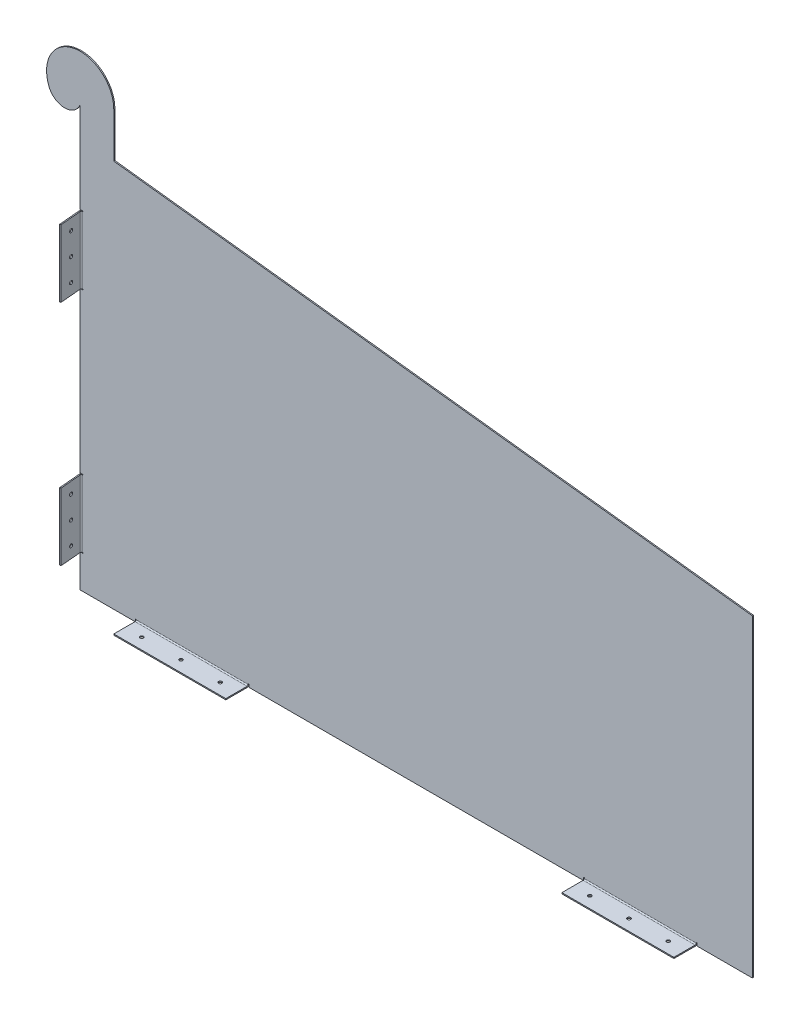
from build123d import *

# Parameters (mm, degrees)
BASE_FLANGE1_DEPTH            = 1
EDGE_FLANGE1_STRIP_W          = 6
EDGE_FLANGE1_STRIP_H          = 1
EDGE_FLANGE1_STRIP_CUT_DEPTH  = 100
EDGE_FLANGE1_RELIEF_W         = 6.5
EDGE_FLANGE1_RELIEF_H         = 0.5
EDGE_FLANGE1_RELIEF_CUT_DEPTH = 1
EDGE_FLANGE1_DEPTH            = 100
EDGE_FLANGE1_PROFILE_W        = 100
EDGE_FLANGE1_PROFILE_H        = 19
EDGE_FLANGE1_PROFILE_R        = 1.5
EDGE_FLANGE1_FLAT_DEPTH       = 1
EDGE_FLANGE2_START            = 29.5
EDGE_FLANGE2_DEPTH            = 61
EDGE_FLANGE2_2_DEPTH          = 0.5
EDGE_FLANGE2_START_2          = 90
EDGE_FLANGE2_3_DEPTH          = 0.5
EDGE_FLANGE2_START_3          = 30
EDGE_FLANGE2_4_DEPTH          = 60
EDGE_FLANGE2_5_OUTLINE_R      = 1.5
EDGE_FLANGE2_5_DEPTH          = 1


with BuildPart() as part:
    # Base-Flange1: sheet metal written as solids
    # Sketch1 → Base-Flange1 (new body)
    with BuildSketch(Plane.XY):
        with BuildLine():
            Line((0, 0), (0, 350))
            Line((0, 350), (0, 375))
            ThreePointArc((0, 375), (-13.854151002, 365.75), (-27.708302005, 375))
            ThreePointArc((-27.708302005, 375), (-5.863059775, 415.921497754), (30, 386.5))
            Line((30, 386.5), (30, 346.5))
            Line((30, 346.5), (600, 280))
            Line((600, 280), (600, 0))
            Line((600, 0), (0, 0))
        make_face()
    extrude(amount=-BASE_FLANGE1_DEPTH)

    # Edge-Flange1: sheet metal written as solids
    # Edge-Flange1 strip (on a plane across the edge) → Edge-Flange1 strip cut (cut)
    with BuildSketch(Plane.YZ.offset(450)):
        with Locations((-1, -0.5)):
            Rectangle(EDGE_FLANGE1_STRIP_W, EDGE_FLANGE1_STRIP_H)
    edge_flange1_strip_cut = extrude(amount=EDGE_FLANGE1_STRIP_CUT_DEPTH, mode=Mode.SUBTRACT)

    # Edge-Flange1 relief (on the sheet) → Edge-Flange1 relief cut (cut)
    with BuildSketch(Plane(origin=(450, 2, 0), x_dir=(0, 1, 0), z_dir=(0, 0, 1))):
        with Locations((-2.75, 0.25)):
            Rectangle(EDGE_FLANGE1_RELIEF_W, EDGE_FLANGE1_RELIEF_H)
        with Locations((-2.75, -100.25)):
            Rectangle(EDGE_FLANGE1_RELIEF_W, EDGE_FLANGE1_RELIEF_H)
    edge_flange1_relief_cut = extrude(amount=-EDGE_FLANGE1_RELIEF_CUT_DEPTH, mode=Mode.SUBTRACT)

    # Edge-Flange1 bend section (on a plane across the edge) → Edge-Flange1 (add)
    with BuildSketch(Plane.YZ.offset(450)):
        with BuildLine():
            Line((0, 1), (1, 1))
            ThreePointArc((1, 1), (1.292893219, 0.292893219), (2, 0))
            Line((2, 0), (2, -1))
            ThreePointArc((2, -1), (0.585786438, -0.414213562), (0, 1))
        make_face()
    edge_flange1 = extrude(amount=EDGE_FLANGE1_DEPTH)

    # Edge-Flange1 profile (on flange) → Edge-Flange1 flat (add)
    with BuildSketch(Plane(origin=(0, 0, 0), x_dir=(-1, 0, 0), z_dir=(0, 1, 0))):
        with Locations((-500, 10.5)):
            Rectangle(EDGE_FLANGE1_PROFILE_W, EDGE_FLANGE1_PROFILE_H)
        with Locations((-535, 10)):
            Circle(EDGE_FLANGE1_PROFILE_R, mode=Mode.SUBTRACT)
        with Locations((-465, 10)):
            Circle(EDGE_FLANGE1_PROFILE_R, mode=Mode.SUBTRACT)
        with Locations((-500, 10)):
            Circle(EDGE_FLANGE1_PROFILE_R, mode=Mode.SUBTRACT)
    edge_flange1_flat = extrude(amount=EDGE_FLANGE1_FLAT_DEPTH)

    # Mirror1: Edge-Flange1 strip cut, Edge-Flange1 relief cut, Edge-Flange1, Edge-Flange1 flat across plane
    add(edge_flange1_strip_cut.mirror(Plane(origin=(300, 0, 0), x_dir=(0, 0, 1), z_dir=(1, 0, 0))), mode=Mode.SUBTRACT)
    add(edge_flange1_relief_cut.mirror(Plane(origin=(300, 0, 0), x_dir=(0, 0, 1), z_dir=(1, 0, 0))), mode=Mode.SUBTRACT)
    add(edge_flange1.mirror(Plane(origin=(300, 0, 0), x_dir=(0, 0, 1), z_dir=(1, 0, 0))))
    add(edge_flange1_flat.mirror(Plane(origin=(300, 0, 0), x_dir=(0, 0, 1), z_dir=(1, 0, 0))))

    # Edge-Flange2: read off the stored shape, not the designer's step
    # Edge-Flange2 outline → Edge-Flange2 (cut)
    with BuildSketch(Plane(origin=(0, 0, 0), x_dir=(1, 0, 0), z_dir=(0, 1, 0)).offset(EDGE_FLANGE2_START)):
        with BuildLine():
            ThreePointArc((0.363077531, 0), (1.095128339, 0.732050808), (2.095128339, 1))
            Line((2.095128339, 1), (0, 1))
            Line((0, 1), (0, 0))
            Line((0, 0), (0.363077531, 0))
        make_face()
    edge_flange2 = extrude(amount=EDGE_FLANGE2_DEPTH, mode=Mode.SUBTRACT)

    # Edge-Flange2 2 outline → Edge-Flange2 2 (cut)
    with BuildSketch(Plane(origin=(0, 0, 0), x_dir=(1, 0, 0), z_dir=(0, 1, 0)).offset(EDGE_FLANGE2_START)):
        with BuildLine():
            Line((2.595128339, 0), (2.595128339, 1))
            Line((2.595128339, 1), (2.095128339, 1))
            ThreePointArc((2.095128339, 1), (1.095128339, 0.732050808), (0.363077531, 0))
            Line((0.363077531, 0), (2.595128339, 0))
        make_face()
    edge_flange2_2 = extrude(amount=EDGE_FLANGE2_2_DEPTH, mode=Mode.SUBTRACT)

    # Edge-Flange2 3 outline → Edge-Flange2 3 (cut)
    with BuildSketch(Plane(origin=(0, 0, 0), x_dir=(1, 0, 0), z_dir=(0, 1, 0)).offset(EDGE_FLANGE2_START_2)):
        with BuildLine():
            Line((2.595128339, 0), (2.595128339, 1))
            Line((2.595128339, 1), (2.095128339, 1))
            ThreePointArc((2.095128339, 1), (1.095128339, 0.732050808), (0.363077531, 0))
            Line((0.363077531, 0), (2.595128339, 0))
        make_face()
    edge_flange2_3 = extrude(amount=EDGE_FLANGE2_3_DEPTH, mode=Mode.SUBTRACT)

    # Edge-Flange2 4 outline → Edge-Flange2 4 (add)
    with BuildSketch(Plane(origin=(0, 0, 0), x_dir=(1, 0, 0), z_dir=(0, 1, 0)).offset(EDGE_FLANGE2_START_3)):
        with BuildLine():
            ThreePointArc((1.098933641, -1.087155743), (1.357851002, -0.324409792), (2.095128339, 0))
            Line((2.095128339, 0), (0.363077531, 0))
            ThreePointArc((0.363077531, 0), (0.142536324, -0.567120772), (0.102738942, -1.174311485))
            Line((0.102738942, -1.174311485), (1.750739994, -20.011049705))
            Line((1.750739994, -20.011049705), (2.746934692, -19.923893962))
            Line((2.746934692, -19.923893962), (1.098933641, -1.087155743))
        make_face()
    edge_flange2_4 = extrude(amount=EDGE_FLANGE2_4_DEPTH)

    # Edge-Flange2 5 outline → Edge-Flange2 5 (cut)
    with BuildSketch(Plane(origin=(0, 0, 0), x_dir=(0, 1, 0), z_dir=(0.9961946980917459, 0, -0.0871557427476548))):
        with Locations((80, 10.087488664)):
            Circle(EDGE_FLANGE2_5_OUTLINE_R)
        with Locations((60, 10.087488664)):
            Circle(EDGE_FLANGE2_5_OUTLINE_R)
        with Locations((40, 10.087488664)):
            Circle(EDGE_FLANGE2_5_OUTLINE_R)
    edge_flange2_5 = extrude(amount=EDGE_FLANGE2_5_DEPTH, mode=Mode.SUBTRACT)

    # Mirror2: Edge-Flange2, Edge-Flange2 2, Edge-Flange2 3, Edge-Flange2 4, Edge-Flange2 5 across plane
    add(edge_flange2.mirror(Plane.ZX.offset(161.81)), mode=Mode.SUBTRACT)
    add(edge_flange2_2.mirror(Plane.ZX.offset(161.81)), mode=Mode.SUBTRACT)
    add(edge_flange2_3.mirror(Plane.ZX.offset(161.81)), mode=Mode.SUBTRACT)
    add(edge_flange2_4.mirror(Plane.ZX.offset(161.81)))
    add(edge_flange2_5.mirror(Plane.ZX.offset(161.81)), mode=Mode.SUBTRACT)


solid = part.part
